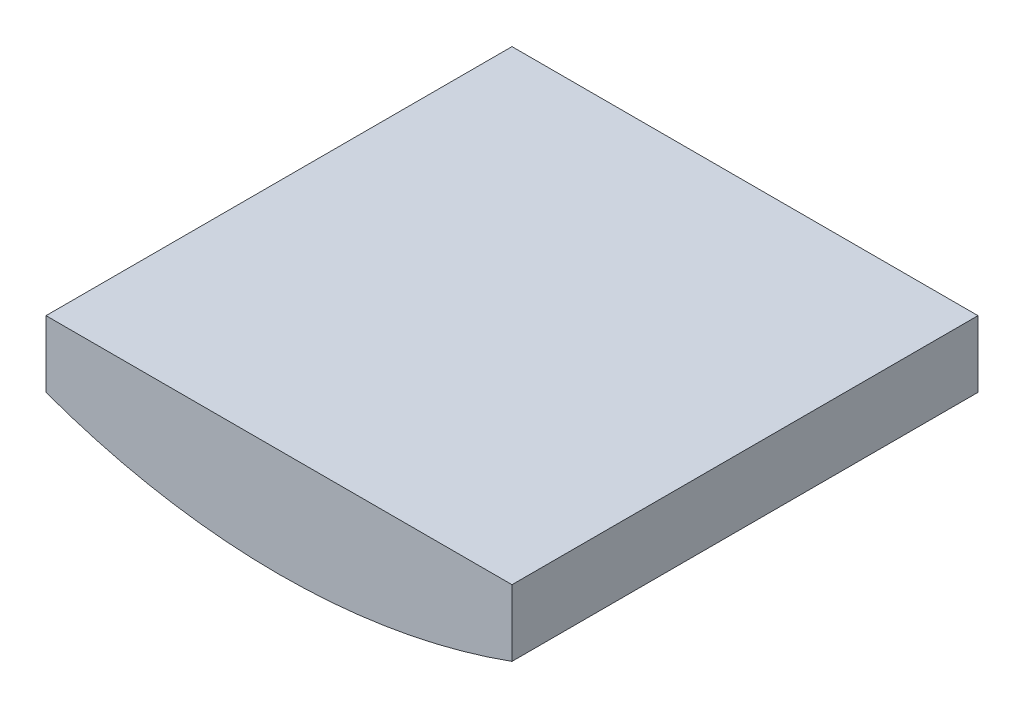
from build123d import *

# Parameters (mm, degrees)
SKIZZE1_W                       = 65
SKIZZE1_H                       = 30
AUFSATZ_LINEAR_AUSTRAGEN1_DEPTH = 65
SCHNITT_LINEAR_START            = -65
SCHNITT_LINEAR_AUSTRAGEN1_DEPTH = 65


# Read off the part's stored shape, not the designer's step: Schnitt-Linear austragen1
with BuildPart() as part:
    # Skizze1 → Aufsatz-Linear austragen1 (new body)
    with BuildSketch(Plane.XY):
        Rectangle(SKIZZE1_W, SKIZZE1_H)
    extrude(amount=AUFSATZ_LINEAR_AUSTRAGEN1_DEPTH)

    # Schnitt-Linear austragen1 outline → Schnitt-Linear austragen1 (cut)
    with BuildSketch(Plane.XY.offset(65).offset(SCHNITT_LINEAR_START)):
        with BuildLine():
            ThreePointArc((32.5, 5.732144643), (0, 0), (-32.5, 5.732144643))
            Line((-32.5, 5.732144643), (-32.5, -15))
            Line((-32.5, -15), (32.5, -15))
            Line((32.5, -15), (32.5, 5.732144643))
        make_face()
    extrude(amount=SCHNITT_LINEAR_AUSTRAGEN1_DEPTH, mode=Mode.SUBTRACT)


solid = part.part
